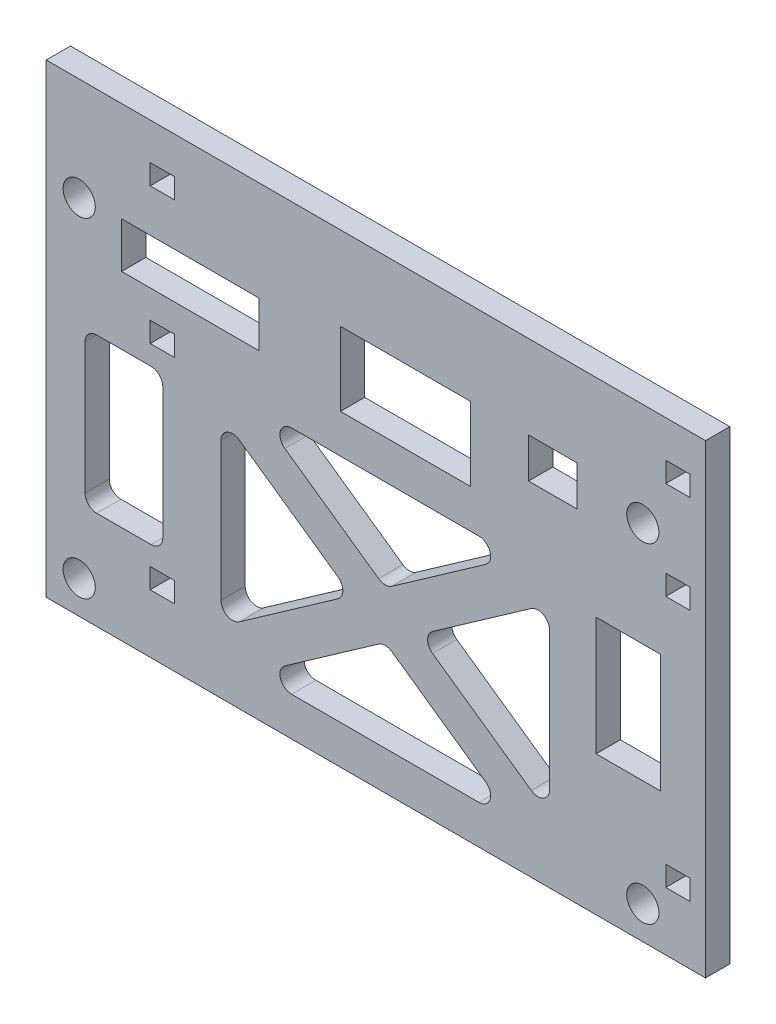
from build123d import *

# Parameters (mm, degrees)
SKETCH1_W                   = 43.18
SKETCH1_H                   = 30.48
SKETCH1_R                   = 1.0541
BOSS_EXTRUDE1_DEPTH         = 1.5875
CAMERA_CUTS_REACH           = 39.386
SKETCH5_W                   = 9
SKETCH5_H                   = 2.985879982
SKETCH5_W_2                 = 8.509
SKETCH5_H_2                 = 4.826
SKETCH5_W_3                 = 3.175
SKETCH5_H_3                 = 2.6162
SKETCH5_W_4                 = 4.22
SKETCH5_H_4                 = 7.75
SKETCH6_W                   = 5.0927
SKETCH6_H                   = 10.1092
WEIGHT_REDUCTION_CUTS_DEPTH = 2.54
ATTACHMENT_CUTS_REACH       = 39.386
SKETCH7_W                   = 1.5875
SKETCH7_H                   = 1.3208
FILLET8_R                   = 0.762


with BuildPart() as part:
    # Sketch1 → Boss-Extrude1 (new body)
    with BuildSketch(Plane.XY):
        with Locations((0, 15.24)):
            Rectangle(SKETCH1_W, SKETCH1_H)
        with Locations((-19.431, 2.159)):
            Circle(SKETCH1_R, mode=Mode.SUBTRACT)
        with Locations((17.48282, 2.159)):
            Circle(SKETCH1_R, mode=Mode.SUBTRACT)
        with Locations((-19.431, 23.749)):
            Circle(SKETCH1_R, mode=Mode.SUBTRACT)
        with Locations((17.48282, 23.749)):
            Circle(SKETCH1_R, mode=Mode.SUBTRACT)
    extrude(amount=BOSS_EXTRUDE1_DEPTH)

    # Sketch5 → Camera Cuts (cut, up to next)
    with BuildSketch(Plane.XY.offset(1.5875), mode=Mode.PRIVATE) as camera_cuts_sk1:
        with Locations((-12.151, 22.450260009)):
            Rectangle(SKETCH5_W, SKETCH5_H)
    camera_cuts_tool1 = extrude(camera_cuts_sk1.sketch, amount=-CAMERA_CUTS_REACH, mode=Mode.PRIVATE) & part.part
    # Sketch5 → Camera Cuts (cut, up to next)
    with BuildSketch(Plane.XY.offset(1.5875), mode=Mode.PRIVATE) as camera_cuts_sk2:
        with Locations((1.9341, 22.597)):
            Rectangle(SKETCH5_W_2, SKETCH5_H_2)
    camera_cuts_tool2 = extrude(camera_cuts_sk2.sketch, amount=-CAMERA_CUTS_REACH, mode=Mode.PRIVATE) & part.part
    # Sketch5 → Camera Cuts (cut, up to next)
    with BuildSketch(Plane.XY.offset(1.5875), mode=Mode.PRIVATE) as camera_cuts_sk3:
        with Locations((11.5861, 23.7019)):
            Rectangle(SKETCH5_W_3, SKETCH5_H_3)
    camera_cuts_tool3 = extrude(camera_cuts_sk3.sketch, amount=-CAMERA_CUTS_REACH, mode=Mode.PRIVATE) & part.part
    # Sketch5 → Camera Cuts (cut, up to next)
    with BuildSketch(Plane.XY.offset(1.5875), mode=Mode.PRIVATE) as camera_cuts_sk4:
        with Locations((16.5326, 13.0085)):
            Rectangle(SKETCH5_W_4, SKETCH5_H_4)
    camera_cuts_tool4 = extrude(camera_cuts_sk4.sketch, amount=-CAMERA_CUTS_REACH, mode=Mode.PRIVATE) & part.part
    add(camera_cuts_tool1.solids().sort_by_distance((-12.151, 22.45026, 1.5875))[0], mode=Mode.SUBTRACT)
    add(camera_cuts_tool2.solids().sort_by_distance((1.9341, 22.597, 1.5875))[0], mode=Mode.SUBTRACT)
    add(camera_cuts_tool3.solids().sort_by_distance((11.5861, 23.7019, 1.5875))[0], mode=Mode.SUBTRACT)
    add(camera_cuts_tool4.solids().sort_by_distance((16.5326, 13.0085, 1.5875))[0], mode=Mode.SUBTRACT)

    # Sketch6 → Weight Reduction Cuts (cut)
    with BuildSketch(Plane.XY.offset(1.5875)):
        Polygon((2.824464201, 10.092), (11.3746, 4.091542275), (11.3746, 16.092457725), align=None)
        Polygon((-7.936485799, 17.644), (0.61365, 11.643542275), (9.163785799, 17.644), align=None)
        Polygon((9.163785799, 2.54), (0.61365, 8.540457725), (-7.936485799, 2.54), align=None)
        Polygon((-10.1473, 4.091542275), (-1.597164201, 10.092), (-10.1473, 16.092457725), align=None)
        with Locations((-16.50365, 11.479427373)):
            Rectangle(SKETCH6_W, SKETCH6_H)
    extrude(amount=-WEIGHT_REDUCTION_CUTS_DEPTH, mode=Mode.SUBTRACT)

    # Sketch7 → Attachment Cuts (cut, up to next)
    with BuildSketch(Plane(origin=(0, 0, 0), x_dir=(-1, 0, 0), z_dir=(0, 0, -1)), mode=Mode.PRIVATE) as attachment_cuts_sk1:
        with Locations((13.98905, 27.405227373)):
            Rectangle(SKETCH7_W, SKETCH7_H)
    attachment_cuts_tool1 = extrude(attachment_cuts_sk1.sketch, amount=-ATTACHMENT_CUTS_REACH, mode=Mode.PRIVATE) & part.part
    # Sketch7 → Attachment Cuts (cut, up to next)
    with BuildSketch(Plane(origin=(0, 0, 0), x_dir=(-1, 0, 0), z_dir=(0, 0, -1)), mode=Mode.PRIVATE) as attachment_cuts_sk2:
        with Locations((13.98905, 18.464427373)):
            Rectangle(SKETCH7_W, SKETCH7_H)
    attachment_cuts_tool2 = extrude(attachment_cuts_sk2.sketch, amount=-ATTACHMENT_CUTS_REACH, mode=Mode.PRIVATE) & part.part
    # Sketch7 → Attachment Cuts (cut, up to next)
    with BuildSketch(Plane(origin=(0, 0, 0), x_dir=(-1, 0, 0), z_dir=(0, 0, -1)), mode=Mode.PRIVATE) as attachment_cuts_sk3:
        with Locations((13.98905, 4.494427373)):
            Rectangle(SKETCH7_W, SKETCH7_H)
    attachment_cuts_tool3 = extrude(attachment_cuts_sk3.sketch, amount=-ATTACHMENT_CUTS_REACH, mode=Mode.PRIVATE) & part.part
    # Sketch7 → Attachment Cuts (cut, up to next)
    with BuildSketch(Plane(origin=(0, 0, 0), x_dir=(-1, 0, 0), z_dir=(0, 0, -1)), mode=Mode.PRIVATE) as attachment_cuts_sk4:
        with Locations((-19.78025, 4.494427373)):
            Rectangle(SKETCH7_W, SKETCH7_H)
    attachment_cuts_tool4 = extrude(attachment_cuts_sk4.sketch, amount=-ATTACHMENT_CUTS_REACH, mode=Mode.PRIVATE) & part.part
    # Sketch7 → Attachment Cuts (cut, up to next)
    with BuildSketch(Plane(origin=(0, 0, 0), x_dir=(-1, 0, 0), z_dir=(0, 0, -1)), mode=Mode.PRIVATE) as attachment_cuts_sk5:
        with Locations((-19.78025, 21.004427373)):
            Rectangle(SKETCH7_W, SKETCH7_H)
    attachment_cuts_tool5 = extrude(attachment_cuts_sk5.sketch, amount=-ATTACHMENT_CUTS_REACH, mode=Mode.PRIVATE) & part.part
    # Sketch7 → Attachment Cuts (cut, up to next)
    with BuildSketch(Plane(origin=(0, 0, 0), x_dir=(-1, 0, 0), z_dir=(0, 0, -1)), mode=Mode.PRIVATE) as attachment_cuts_sk6:
        with Locations((-19.78025, 27.405227373)):
            Rectangle(SKETCH7_W, SKETCH7_H)
    attachment_cuts_tool6 = extrude(attachment_cuts_sk6.sketch, amount=-ATTACHMENT_CUTS_REACH, mode=Mode.PRIVATE) & part.part
    add(attachment_cuts_tool1.solids().sort_by_distance((-13.98905, 27.405227, 0))[0], mode=Mode.SUBTRACT)
    add(attachment_cuts_tool2.solids().sort_by_distance((-13.98905, 18.464427, 0))[0], mode=Mode.SUBTRACT)
    add(attachment_cuts_tool3.solids().sort_by_distance((-13.98905, 4.494427, 0))[0], mode=Mode.SUBTRACT)
    add(attachment_cuts_tool4.solids().sort_by_distance((19.78025, 4.494427, 0))[0], mode=Mode.SUBTRACT)
    add(attachment_cuts_tool5.solids().sort_by_distance((19.78025, 21.004427, 0))[0], mode=Mode.SUBTRACT)
    add(attachment_cuts_tool6.solids().sort_by_distance((19.78025, 27.405227, 0))[0], mode=Mode.SUBTRACT)

    # Fillet8
    fillet8_edges = [part.edges().sort_by_distance(p)[0] for p in [
        (-10.1473, 4.091542275, 0.79375),
        (-7.936485799, 2.54, 0.79375),
        (9.163785799, 2.54, 0.79375),
        (11.3746, 4.091542275, 0.79375),
        (0.61365, 11.643542275, 0.79375),
        (-7.936485799, 17.644, 0.79375),
        (2.824464201, 10.092, 0.79375),
        (0.61365, 8.540457725, 0.79375),
        (-10.1473, 16.092457725, 0.79375),
        (9.163785799, 17.644, 0.79375),
        (-1.597164201, 10.092, 0.79375),
        (11.3746, 16.092457725, 0.79375),
        (-19.05, 16.534027373, 0.79375),
        (-19.05, 6.424827373, 0.79375),
        (-13.9573, 6.424827373, 0.79375),
        (-13.9573, 16.534027373, 0.79375),
    ]]
    fillet(fillet8_edges, radius=FILLET8_R)


solid = part.part
